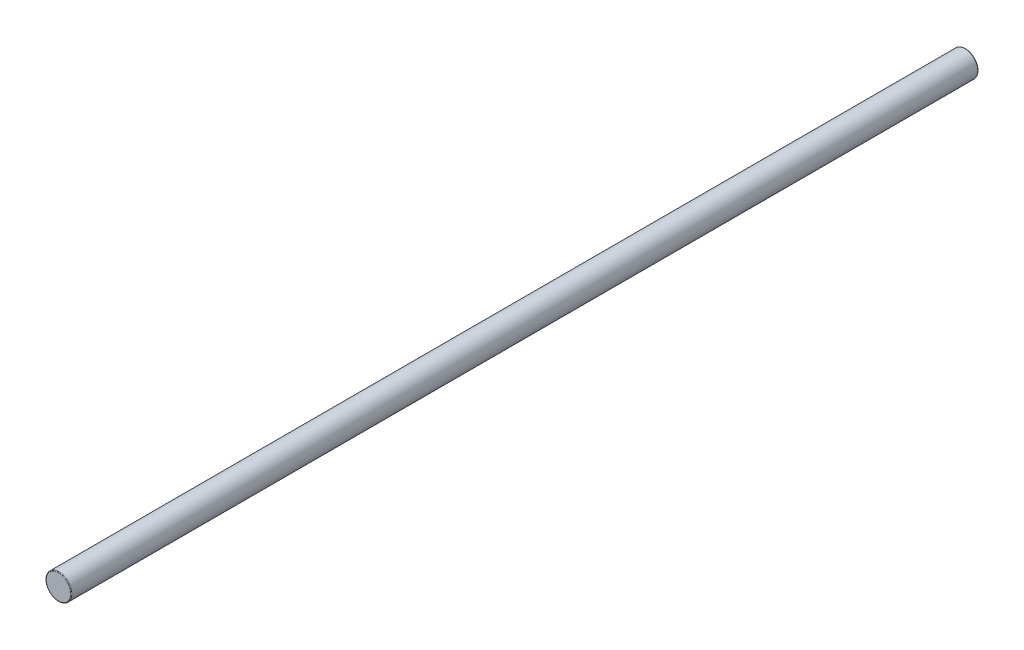
from build123d import *

# Parameters (mm, degrees)
SKETCH1_R           = 4
BOSS_EXTRUDE1_DEPTH = 283
FILLET1_R           = 0.2


with BuildPart() as part:
    # Sketch1 → Boss-Extrude1 (new body)
    with BuildSketch(Plane.XY):
        Circle(SKETCH1_R)
    extrude(amount=-BOSS_EXTRUDE1_DEPTH)

    # Fillet1
    fillet1_edges = [part.edges().sort_by_distance(p)[0] for p in [
        (-4, 0, -283),
        (-4, 0, 0),
    ]]
    fillet(fillet1_edges, radius=FILLET1_R)


solid = part.part
